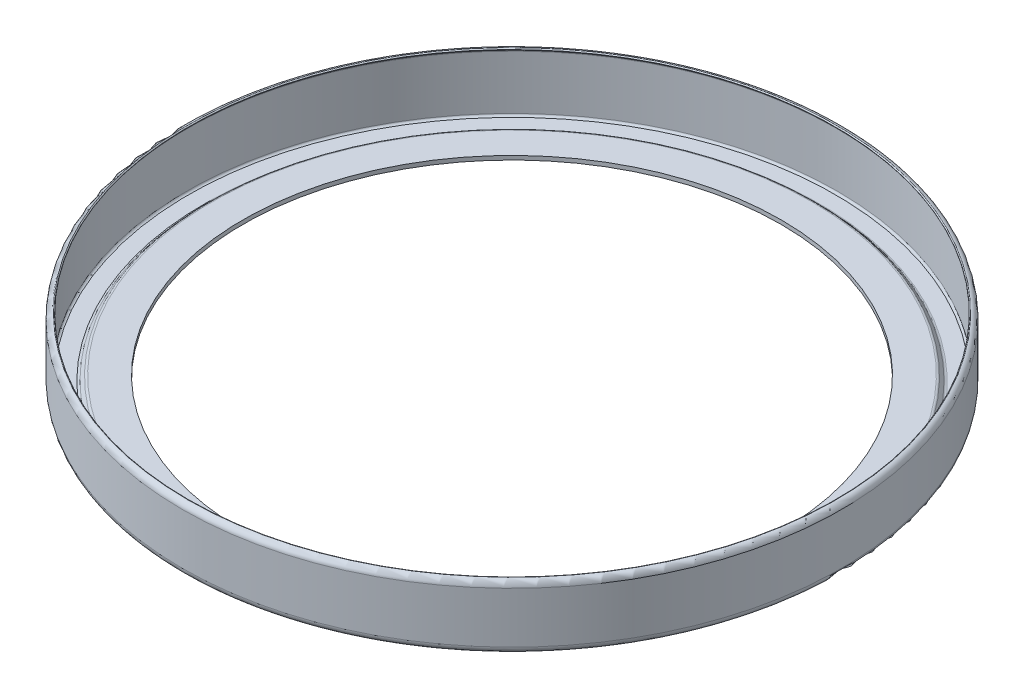
from build123d import *

# Parameters (mm, degrees)
FILETE2_R = 0.25
FILETE3_R = 1.5
FILETE4_R = 0.5
FILETE5_R = 1.75
FILETE6_R = 0.5
FILETE7_R = 0.75


# Some blends are built 0.0001 mm under size
with BuildPart() as part:
    # Esboço1 → Revolução1 (revolve)
    with BuildSketch(Plane.XY, mode=Mode.PRIVATE) as revolu_o1_sk:
        Polygon((81, 7.575562227), (81, 8.075562227), (82.55, 8.075562227), (82.55, -7.924437773), (76.75, -7.924437773), (75.5, -6.524437773), (67.4, -6.524437773), (67.4, -5.524437773), (75.5, -5.524437773), (76.75, -6.924437773), (81.55, -6.924437773), (81.55, 7.575562227), align=None)
    revolve(revolu_o1_sk.sketch.rotate(Axis((0, -52.002491694, 0), (0, 1, 0)), 90), axis=Axis((0, -52.002491694, 0), (0, 1, 0)))

    # Filete2
    filete2_edges = [part.edges().sort_by_distance(p)[0] for p in [
        (0, 8.075562227, 81),
        (0, 7.575562227, 81),
    ]]
    fillet(filete2_edges, radius=FILETE2_R - 0.0001)  # a hair under: the kernel refuses the full size

    # Filete3
    # the kernel refuses this fillet: 1.5 mm, written as the material it takes off along each edge
    with BuildSketch(Plane(origin=(0, 8.075562227, 0), x_dir=(0, 0, -1), z_dir=(1, 0, 0))) as filete3_piece_1:
        with BuildLine():
            CenterArc((81.05, -1.486620325), FILETE3_R, 0, 82.341598453)
            Line((82.55, -1.486620325), (82.58, -1.486620325))
            Line((82.58, -1.486620325), (82.58, 0))
            Line((82.58, 0), (82.55, 0.03))
            ThreePointArc((82.55, 0.03), (81.89995, 0.03), (81.253898, 0.029732406))
            Line((81.253898, 0.029732406), (81.2499, 0))
        make_face()
    revolve(axis=Axis((0, 8.075562227, 0), (0, 1, 0)), mode=Mode.SUBTRACT)

    # Filete4
    filete4_edges = [part.edges().sort_by_distance(p)[0] for p in [
        (0, 7.575562227, 81.55),
    ]]
    fillet(filete4_edges, radius=FILETE4_R)

    # Filete5
    filete5_edges = [part.edges().sort_by_distance(p)[0] for p in [
        (0, -7.924437773, 82.55),
    ]]
    fillet(filete5_edges, radius=FILETE5_R)

    # Filete6
    filete6_edges = [part.edges().sort_by_distance(p)[0] for p in [
        (0, -6.924437773, 81.55),
    ]]
    fillet(filete6_edges, radius=FILETE6_R)

    # Filete7
    filete7_edges = [part.edges().sort_by_distance(p)[0] for p in [
        (0, -6.524437773, 75.5),
        (0, -7.924437773, 76.75),
        (0, -6.924437773, 76.75),
        (0, -5.524437773, 75.5),
    ]]
    fillet(filete7_edges, radius=FILETE7_R)


solid = part.part
